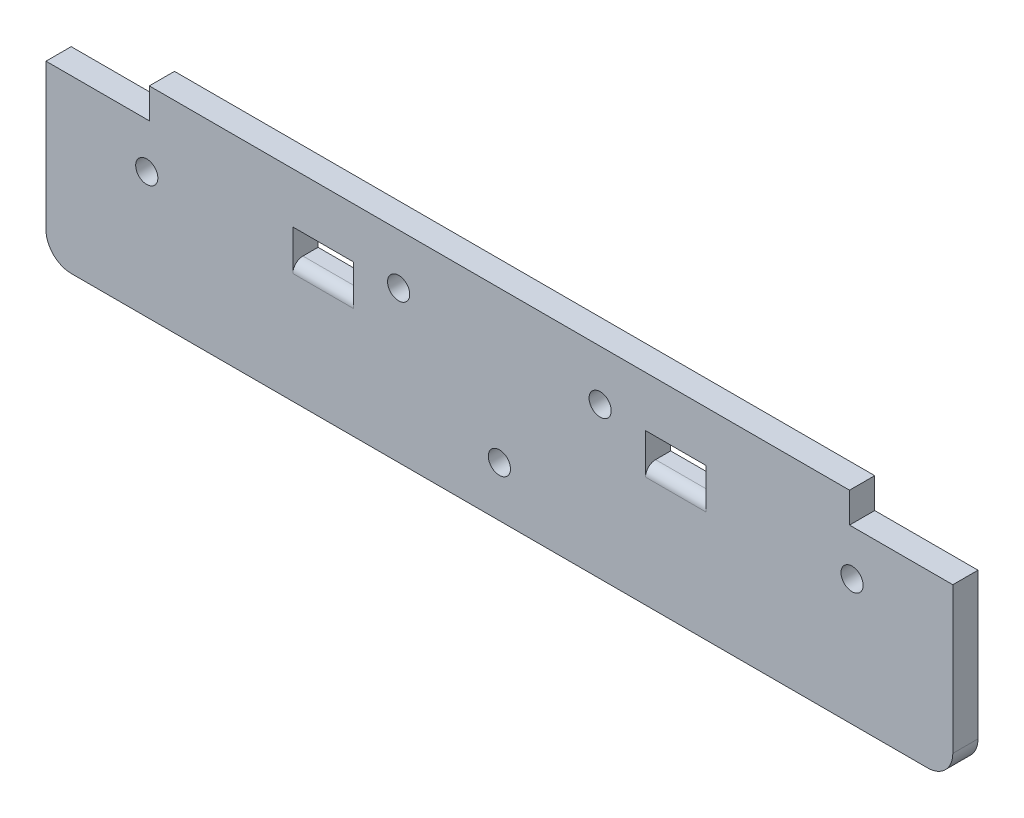
from build123d import *

# Parameters (mm, degrees)
SZKIC1_W                    = 180
SZKIC1_H                    = 40
DODANIE_WYCI_GNI_CIE1_DEPTH = 5
ZAOKR_GLENIE1_R             = 5
SZKIC2_R                    = 2.2
WYTNIJ_WYCI_GNI_CIE1_DEPTH  = 5
SZKIC3_W                    = 20.5
SZKIC3_H                    = 6
WYTNIJ_WYCI_GNI_CIE2_DEPTH  = 10
SZKIC4_R                    = 2.2
WYTNIJ_WYCI_GNI_CIE3_DEPTH  = 10
SZKIC5_W                    = 12
SZKIC5_H                    = 6
WYTNIJ_WYCI_GNI_CIE4_DEPTH  = 93.330926563
ZAOKR_GLENIE2_R             = 2


with BuildPart() as part:
    # Szkic1 → Dodanie-wyciągnięcie1 (new body)
    with BuildSketch(Plane.XY):
        Rectangle(SZKIC1_W, SZKIC1_H)
    extrude(amount=DODANIE_WYCI_GNI_CIE1_DEPTH)

    # Zaokrąglenie1
    zaokr_glenie1_edges = [part.edges().sort_by_distance(p)[0] for p in [
        (-90, 20, 2.5),
        (-90, -20, 2.5),
        (90, -20, 2.5),
        (90, 20, 2.5),
    ]]
    fillet(zaokr_glenie1_edges, radius=ZAOKR_GLENIE1_R)

    # Szkic2 → Wytnij-wyciągnięcie1 (cut)
    with BuildSketch(Plane.XY.offset(5)):
        with Locations((-70, 5)):
            Circle(SZKIC2_R)
        with Locations((-20, 10)):
            Circle(SZKIC2_R)
        with Locations((20, 10)):
            Circle(SZKIC2_R)
        with Locations((70, 5)):
            Circle(SZKIC2_R)
    extrude(amount=-WYTNIJ_WYCI_GNI_CIE1_DEPTH, mode=Mode.SUBTRACT)

    # Szkic3 → Wytnij-wyciągnięcie2 (cut)
    with BuildSketch(Plane.XY.offset(5)):
        with Locations((-79.75, 17)):
            Rectangle(SZKIC3_W, SZKIC3_H)
        with Locations((79.75, 17)):
            Rectangle(SZKIC3_W, SZKIC3_H)
    extrude(amount=-WYTNIJ_WYCI_GNI_CIE2_DEPTH, mode=Mode.SUBTRACT)

    # Szkic4 → Wytnij-wyciągnięcie3 (cut)
    with BuildSketch(Plane.XY.offset(5)):
        with Locations((0, -10)):
            Circle(SZKIC4_R)
    extrude(amount=-WYTNIJ_WYCI_GNI_CIE3_DEPTH, mode=Mode.SUBTRACT)

    # Szkic5 → Wytnij-wyciągnięcie4 (cut, through all)
    with BuildSketch(Plane.XY.offset(5)):
        with Locations((-35, 7)):
            Rectangle(SZKIC5_W, SZKIC5_H)
        with Locations((35, 7)):
            Rectangle(SZKIC5_W, SZKIC5_H)
    extrude(amount=-WYTNIJ_WYCI_GNI_CIE4_DEPTH, mode=Mode.SUBTRACT)

    # Zaokrąglenie2
    zaokr_glenie2_edges = [part.edges().sort_by_distance(p)[0] for p in [
        (-35, 4, 5),
        (35, 4, 5),
    ]]
    fillet(zaokr_glenie2_edges, radius=ZAOKR_GLENIE2_R)


solid = part.part
